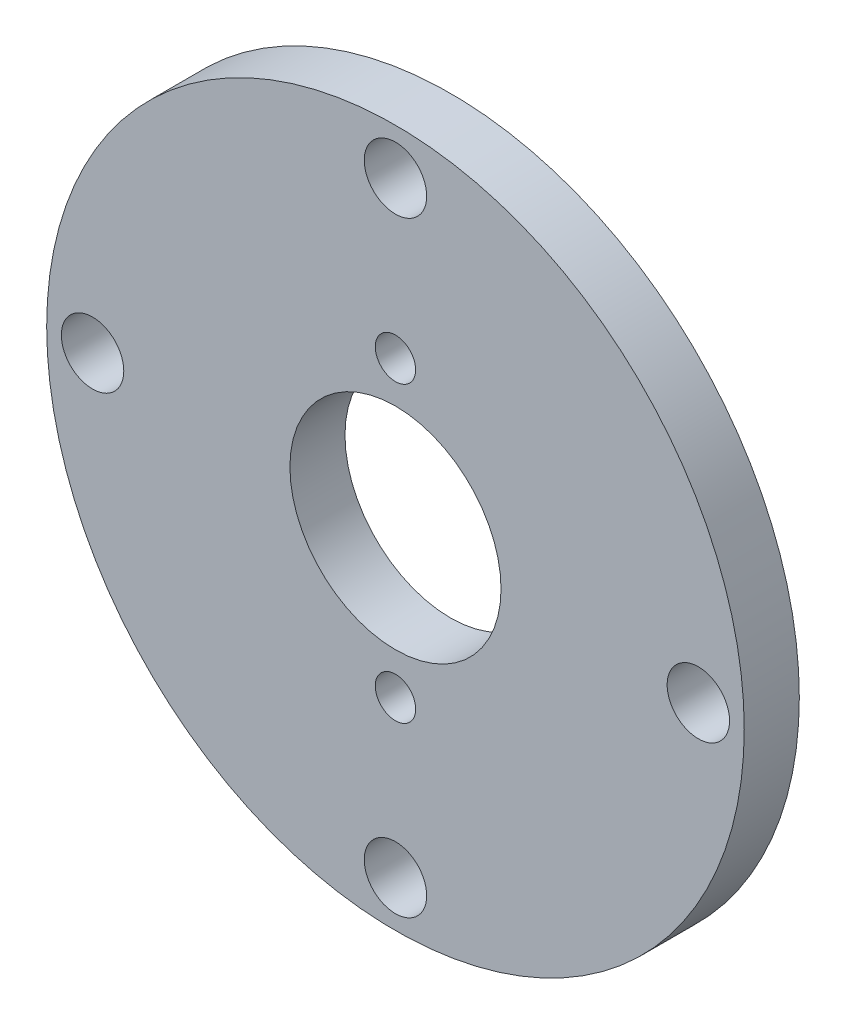
from build123d import *

# Parameters (mm, degrees)
SKETCH1_R           = 19
SKETCH1_R_2         = 1.1
SKETCH1_R_3         = 5.75
SKETCH1_R_4         = 1.7
BOSS_EXTRUDE1_DEPTH = 3


with BuildPart() as part:
    # Sketch1 → Boss-Extrude1 (new body)
    with BuildSketch(Plane.XY):
        Circle(SKETCH1_R)
        with Locations((0, -8)):
            Circle(SKETCH1_R_2, mode=Mode.SUBTRACT)
        Circle(SKETCH1_R_3, mode=Mode.SUBTRACT)
        with Locations((0, 8)):
            Circle(SKETCH1_R_2, mode=Mode.SUBTRACT)
        with Locations((0, -16.5)):
            Circle(SKETCH1_R_4, mode=Mode.SUBTRACT)
        with Locations((-16.5, 0)):
            Circle(SKETCH1_R_4, mode=Mode.SUBTRACT)
        with Locations((0, 16.5)):
            Circle(SKETCH1_R_4, mode=Mode.SUBTRACT)
        with Locations((16.5, 0)):
            Circle(SKETCH1_R_4, mode=Mode.SUBTRACT)
    extrude(amount=BOSS_EXTRUDE1_DEPTH)


solid = part.part
